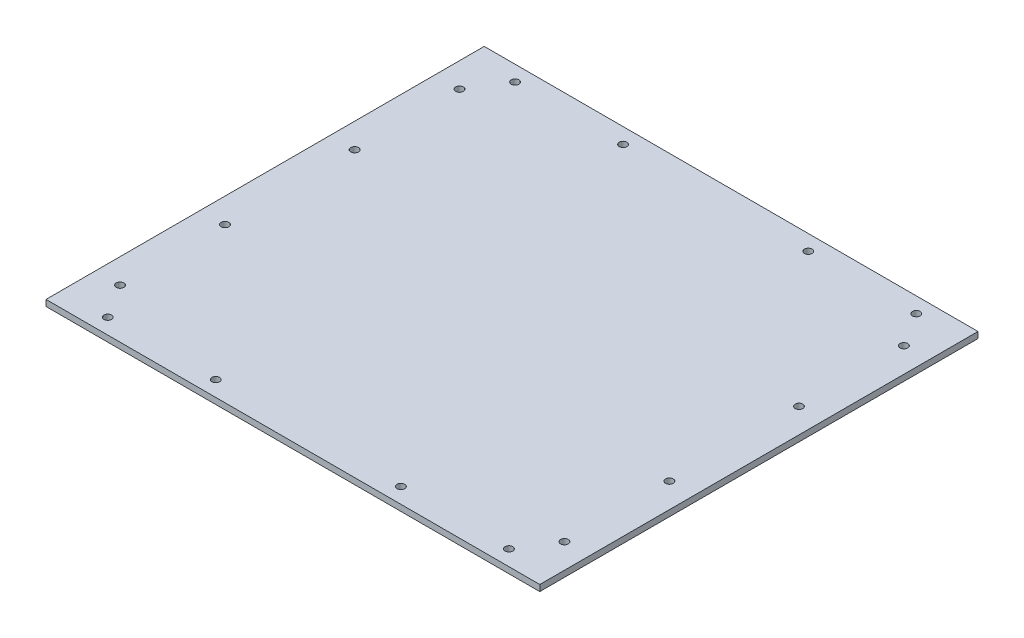
from build123d import *

# Parameters (mm, degrees)
SKETCH2_W               = 160
SKETCH2_H               = 142
BOSS_EXTRUDE1_DEPTH     = 2
CUT_EXTRUDE2_DEPTH      = 160.150871817
CUT_EXTRUDE2_DEPTH_BACK = 160.150871817
SKETCH5_R               = 1.25
SKETCH6_W               = 3
SKETCH6_H               = 20
BOSS_EXTRUDE2_DEPTH     = 5
SKETCH7_W               = 144
SKETCH7_H               = 3
SKETCH7_W_2             = 3
SKETCH7_H_2             = 76
EXTRUDE_THIN1_DEPTH     = 5
FILLET6_R               = 3
FILLET1_R               = 5
FILLET7_R               = 3


with BuildPart() as part:
    # Sketch2 → Boss-Extrude1 (new body)
    with BuildSketch(Plane(origin=(0, 0, 0), x_dir=(1, 0, 0), z_dir=(0, 1, 0))):
        with Locations((35, -39)):
            Rectangle(SKETCH2_W, SKETCH2_H)
    extrude(amount=BOSS_EXTRUDE1_DEPTH)

    # Sketch5 → Cut-Extrude2 (cut, two sides: drawn at the far end of the back side and taken through both)
    with BuildSketch(Plane(origin=(0, 0, 0), x_dir=(1, 0, 0), z_dir=(0, 1, 0)).offset(-CUT_EXTRUDE2_DEPTH_BACK)):
        with Locations(Location((-37, -18, 0), (0, 0, 270))):
            Circle(SKETCH5_R)
        with Locations(Location((-37, 16, 0), (0, 0, 270))):
            Circle(SKETCH5_R)
        with Locations(Location((-30, 27, 0), (0, 0, 270))):
            Circle(SKETCH5_R)
        with Locations(Location((5, 27, 0), (0, 0, 270))):
            Circle(SKETCH5_R)
        with Locations(Location((65, 27, 0), (0, 0, 270))):
            Circle(SKETCH5_R)
        with Locations(Location((100, 27, 0), (0, 0, 270))):
            Circle(SKETCH5_R)
        with Locations(Location((107, 16, 0), (0, 0, 270))):
            Circle(SKETCH5_R)
        with Locations(Location((107, -18, 0), (0, 0, 270))):
            Circle(SKETCH5_R)
        with Locations(Location((107, -60, 0), (0, 0, 270))):
            Circle(SKETCH5_R)
        with Locations(Location((107, -94, 0), (0, 0, 270))):
            Circle(SKETCH5_R)
        with Locations(Location((65, -105, 0), (0, 0, 270))):
            Circle(SKETCH5_R)
        with Locations(Location((100, -105, 0), (0, 0, 270))):
            Circle(SKETCH5_R)
        with Locations(Location((5, -105, 0), (0, 0, 270))):
            Circle(SKETCH5_R)
        with Locations(Location((-30, -105, 0), (0, 0, 270))):
            Circle(SKETCH5_R)
        with Locations(Location((-37, -94, 0), (0, 0, 270))):
            Circle(SKETCH5_R)
        with Locations(Location((-37, -60, 0), (0, 0, 270))):
            Circle(SKETCH5_R)
    extrude(amount=CUT_EXTRUDE2_DEPTH + CUT_EXTRUDE2_DEPTH_BACK, mode=Mode.SUBTRACT)

    # Sketch6 → Boss-Extrude2 (add)
    with BuildSketch(Plane(origin=(0, 0, 0), x_dir=(1, 0, 0), z_dir=(0, 1, 0))):
        with Locations((-38.5, -1)):
            Rectangle(SKETCH6_W, SKETCH6_H)
        with Locations((-38.5, -39)):
            Rectangle(SKETCH6_W, SKETCH6_H)
        with Locations((-38.5, -77)):
            Rectangle(SKETCH6_W, SKETCH6_H)
        with Locations((108.5, -77)):
            Rectangle(SKETCH6_W, SKETCH6_H)
        with Locations((108.5, -39)):
            Rectangle(SKETCH6_W, SKETCH6_H)
        with Locations((108.5, -1)):
            Rectangle(SKETCH6_W, SKETCH6_H)
    extrude(amount=-BOSS_EXTRUDE2_DEPTH)

    # Sketch7 → Extrude-Thin1 (add)
    with BuildSketch(Plane(origin=(0, 0, 0), x_dir=(1, 0, 0), z_dir=(0, 1, 0))):
        with Locations((35, -1)):
            Rectangle(SKETCH7_W, SKETCH7_H)
        with Locations((35, -77)):
            Rectangle(SKETCH7_W, SKETCH7_H)
        with Locations((35, -39)):
            Rectangle(SKETCH7_W_2, SKETCH7_H_2)
    extrude(amount=-EXTRUDE_THIN1_DEPTH)

    # Fillet6
    fillet6_edges = [part.edges().sort_by_distance(p)[0] for p in [
        (33.5, -2.5, 2.5),
        (107, -2.5, 2.5),
        (-37, -2.5, 2.5),
        (-37, -2.5, -0.5),
        (107, -2.5, -0.5),
        (-37, -2.5, 75.5),
        (107, -2.5, 78.5),
        (-37, -2.5, 78.5),
        (36.5, -2.5, 75.5),
        (107, -2.5, 75.5),
        (36.5, -2.5, 2.5),
        (33.5, -2.5, 75.5),
    ]]
    fillet(fillet6_edges, radius=FILLET6_R)

    # Fillet1
    fillet1_edges = [part.edges().sort_by_distance(p)[0] for p in [
        (107, 0, 39),
        (-37, 0, 39),
    ]]
    fillet(fillet1_edges, radius=FILLET1_R - 0.0001)  # a hair under: the kernel refuses the full size

    # Fillet7
    fillet7_edges = [part.edges().sort_by_distance(p)[0] for p in [
        (-37, 0, 84.25),
        (107, 0, 69.75),
        (107, 0, -6.25),
        (-1.75, 0, 2.5),
        (35, 0, -0.5),
        (-37, 0, -6.25),
        (33.5, 0, 39),
        (-1.75, 0, 75.5),
        (-37, 0, 69.75),
        (35, 0, 78.5),
        (107, 0, 84.25),
        (71.75, 0, 75.5),
        (36.5, 0, 39),
        (71.75, 0, 2.5),
        (107, 0, 8.25),
        (32.621320344, 0, 74.621320344),
        (37.378679656, 0, 74.621320344),
        (-36.121320344, 0, 74.621320344),
        (-36.121320344, 0, 79.378679656),
        (106.121320344, 0, 79.378679656),
        (106.121320344, 0, 74.621320344),
        (106.121320344, 0, -1.378679656),
        (-36.121320344, 0, -1.378679656),
        (-36.121320344, 0, 3.378679656),
        (37.378679656, 0, 3.378679656),
        (106.121320344, 0, 3.378679656),
        (32.621320344, 0, 3.378679656),
        (-37, 0, 8.25),
    ]]
    fillet(fillet7_edges, radius=FILLET7_R)


solid = part.part
